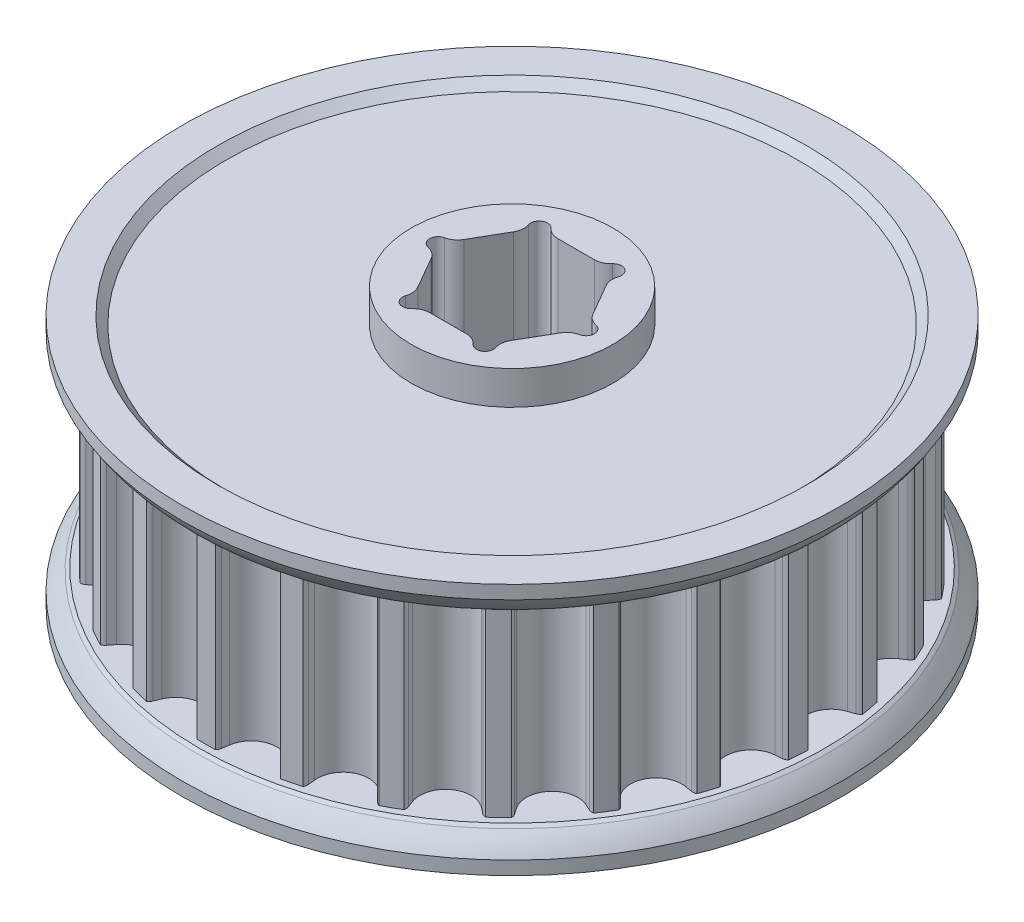
from build123d import *

# Parameters (mm, degrees)
SKETCH1_R           = 11.555621114
TOOTHOD_DEPTH       = 3.4925
TOOTHPROFILE_DEPTH  = 17.711143435
TOOTHPATTERN_COUNT  = 25
BORE_DEPTH          = 19.232350249
BORE_DEPTH_BACK     = 19.232350249
SKETCH11_R          = 7.9375
CUT_EXTRUDE1_DEPTH  = 0.3175
SKETCH10_R          = 3.81
BOSS_EXTRUDE1_DEPTH = 1.27
CHAMFER1_SIZE       = 3.175
CUT_EXTRUDE3_DEPTH  = 3.175
FILLET2_R           = 0.635
SKETCH12_R          = 0.3175
CUT_EXTRUDE2_DEPTH  = 21.4820701
FILLET1_R           = 0.635


with BuildPart() as part:
    # Sketch1 → ToothOD (new, symmetric)
    with BuildSketch(Plane(origin=(0, 0, 0), x_dir=(1, 0, 0), z_dir=(0, 1, 0))):
        with Locations(Location((0, 0, 0), (0, 0, 270))):
            Circle(SKETCH1_R)
    extrude(amount=TOOTHOD_DEPTH, both=True)

    # Sketch2 → ToothProfile (cut, symmetric)
    with BuildSketch(Plane(origin=(0, 0, 0), x_dir=(1, 0, 0), z_dir=(0, 1, 0))):
        with BuildLine():
            ThreePointArc((-0.937033068, 11.10568311), (-0.590385173, 10.5875085), (0, 10.387221114))
            ThreePointArc((0, 10.387221114), (0.590385173, 10.5875085), (0.937033068, 11.10568311))
            ThreePointArc((0.937033068, 11.10568311), (0.971699064, 11.231794572), (1.007805813, 11.357501114))
            ThreePointArc((1.007805813, 11.357501114), (1.044604842, 11.43722658), (1.102929706, 11.502865964))
            ThreePointArc((1.102929706, 11.502865964), (0, 11.555621114), (-1.102929706, 11.502865964))
            ThreePointArc((-1.102929706, 11.502865964), (-1.044604842, 11.43722658), (-1.007805813, 11.357501114))
            ThreePointArc((-1.007805813, 11.357501114), (-0.971699064, 11.231794572), (-0.937033068, 11.10568311))
        make_face()
    toothprofile = extrude(amount=TOOTHPROFILE_DEPTH, both=True, mode=Mode.SUBTRACT)

    # ToothPattern: ToothProfile ×25 about axis
    toothpattern_axis = Axis((0, 0, 0), (0, 1, 0))
    for i in range(1, TOOTHPATTERN_COUNT):
        add(toothprofile.rotate(toothpattern_axis, i * 360 / TOOTHPATTERN_COUNT), mode=Mode.SUBTRACT)

    # Sketch4 → Flange (revolve)
    with BuildSketch(Plane.XY, mode=Mode.PRIVATE) as flange_sk:
        with BuildLine():
            Line((0, -3.4925), (11.809621114, -3.4925))
            ThreePointArc((11.809621114, -3.4925), (11.87383417, -3.537841157), (11.936621114, -3.585137424))
            ThreePointArc((11.936621114, -3.585137424), (12.212662712, -3.90309066), (12.444621114, -4.2545))
            Line((12.444621114, -4.2545), (12.444621114, -4.7625))
            Line((12.444621114, -4.7625), (0, -4.7625))
            Line((0, -4.7625), (0, -3.4925))
        make_face()
        with BuildLine():
            Line((12.444621114, 4.7625), (12.444621114, 4.2545))
            ThreePointArc((12.444621114, 4.2545), (12.212662712, 3.90309066), (11.936621114, 3.585137424))
            ThreePointArc((11.936621114, 3.585137424), (11.87383417, 3.537841157), (11.809621114, 3.4925))
            Line((11.809621114, 3.4925), (0, 3.4925))
            Line((0, 3.4925), (0, 4.7625))
            Line((0, 4.7625), (12.444621114, 4.7625))
        make_face()
    revolve(flange_sk.sketch.rotate(Axis((0, 8.73125, 0), (0, -1, 0)), 90), axis=Axis((0, 8.73125, 0), (0, -1, 0)))

    # Sketch7 → Bore (cut, two sides: drawn at the far end of the back side and taken through both)
    with BuildSketch(Plane.XZ.offset(-BORE_DEPTH_BACK)):
        Polygon((1.396812374, 2.41935), (-1.396812374, 2.41935), (-2.793624748, 0), (-1.396812374, -2.41935), (1.396812374, -2.41935), (2.793624748, 0), align=None)
    extrude(amount=BORE_DEPTH + BORE_DEPTH_BACK, mode=Mode.SUBTRACT)

    # Sketch11 → Cut-Extrude1 (cut)
    with BuildSketch(Plane(origin=(0, 4.7625, 0), x_dir=(1, 0, 0), z_dir=(0, 1, 0))):
        with Locations(Location((0, 0, 0), (0, 0, 270))):
            Circle(SKETCH11_R)
    extrude(amount=-CUT_EXTRUDE1_DEPTH, mode=Mode.SUBTRACT)

    # Sketch10 → Boss-Extrude1 (add)
    with BuildSketch(Plane(origin=(0, 4.445, 0), x_dir=(1, 0, 0), z_dir=(0, 1, 0))):
        with Locations(Location((0, 0, 0), (0, 0, 270))):
            Circle(SKETCH10_R)
        Polygon((1.396812374, -2.41935), (2.793624748, 0), (1.396812374, 2.41935), (-1.396812374, 2.41935), (-2.793624748, 0), (-1.396812374, -2.41935), align=None, mode=Mode.SUBTRACT)
    extrude(amount=BOSS_EXTRUDE1_DEPTH)

    # Chamfer1
    # the kernel refuses this chamfer: 3.175 mm, written as the material it takes off along each edge
    with BuildSketch(Plane(origin=(0, 4.7625, 0), x_dir=(0, 0, 1), z_dir=(-1, 0, 0))) as chamfer1_piece_1_section:
        Polygon((7.9375 + CHAMFER1_SIZE, 0), (7.9375, -CHAMFER1_SIZE), (7.9375, 0), align=None)
    chamfer1_piece_1 = revolve(axis=Axis((0, 4.7625, 0), (0, 1, 0)), mode=Mode.PRIVATE)
    chamfer1_piece_1 = split(chamfer1_piece_1, bisect_by=Plane(origin=(0, 4.445, -10.96903061), z_dir=(0, 1, 0)), keep=Keep.TOP, mode=Mode.PRIVATE)
    add(chamfer1_piece_1, mode=Mode.SUBTRACT)

    # Sketch13 → Cut-Extrude3 (cut)
    with BuildSketch(Plane.XZ.offset(4.7625)):
        Polygon((2.822954141, -4.8895), (5.645908282, 0), (2.822954141, 4.8895), (-2.822954141, 4.8895), (-5.645908282, 0), (-2.822954141, -4.8895), align=None)
    extrude(amount=-CUT_EXTRUDE3_DEPTH, mode=Mode.SUBTRACT)

    # Fillet2
    fillet2_edges = [part.edges().sort_by_distance(p)[0] for p in [
        (2.822954141, -3.175, -4.8895),
        (-2.822954141, -3.175, -4.8895),
        (-5.645908282, -3.175, 0),
        (-2.822954141, -3.175, 4.8895),
        (2.822954141, -3.175, 4.8895),
        (5.645908282, -3.175, 0),
    ]]
    fillet(fillet2_edges, radius=FILLET2_R)

    # Sketch12 → Cut-Extrude2 (cut, through all)
    with BuildSketch(Plane.XZ.offset(4.7625)):
        with Locations((1.396812374, 2.41935)):
            Circle(SKETCH12_R)
        with Locations((2.793624748, 0)):
            Circle(SKETCH12_R)
        with Locations((1.396812374, -2.41935)):
            Circle(SKETCH12_R)
        with Locations((-1.396812374, -2.41935)):
            Circle(SKETCH12_R)
        with Locations((-2.793624748, 0)):
            Circle(SKETCH12_R)
        with Locations((-1.396812374, 2.41935)):
            Circle(SKETCH12_R)
    extrude(amount=-CUT_EXTRUDE2_DEPTH, mode=Mode.SUBTRACT)

    # Fillet1
    fillet1_edges = [part.edges().sort_by_distance(p)[0] for p in [
        (-1.555562374, 2.06375, 2.144386934),
        (-1.079312374, 2.06375, 2.41935),
        (-2.634874748, 2.06375, -0.274963066),
        (-2.634874748, 2.06375, 0.274963066),
        (-1.079312374, 2.06375, -2.41935),
        (-1.555562374, 2.06375, -2.144386934),
        (1.555562374, 2.06375, -2.144386934),
        (1.079312374, 2.06375, -2.41935),
        (2.634874748, 2.06375, 0.274963066),
        (2.634874748, 2.06375, -0.274963066),
        (1.555562374, 2.06375, 2.144386934),
        (1.079312374, 2.06375, 2.41935),
    ]]
    fillet(fillet1_edges, radius=FILLET1_R)


solid = part.part
